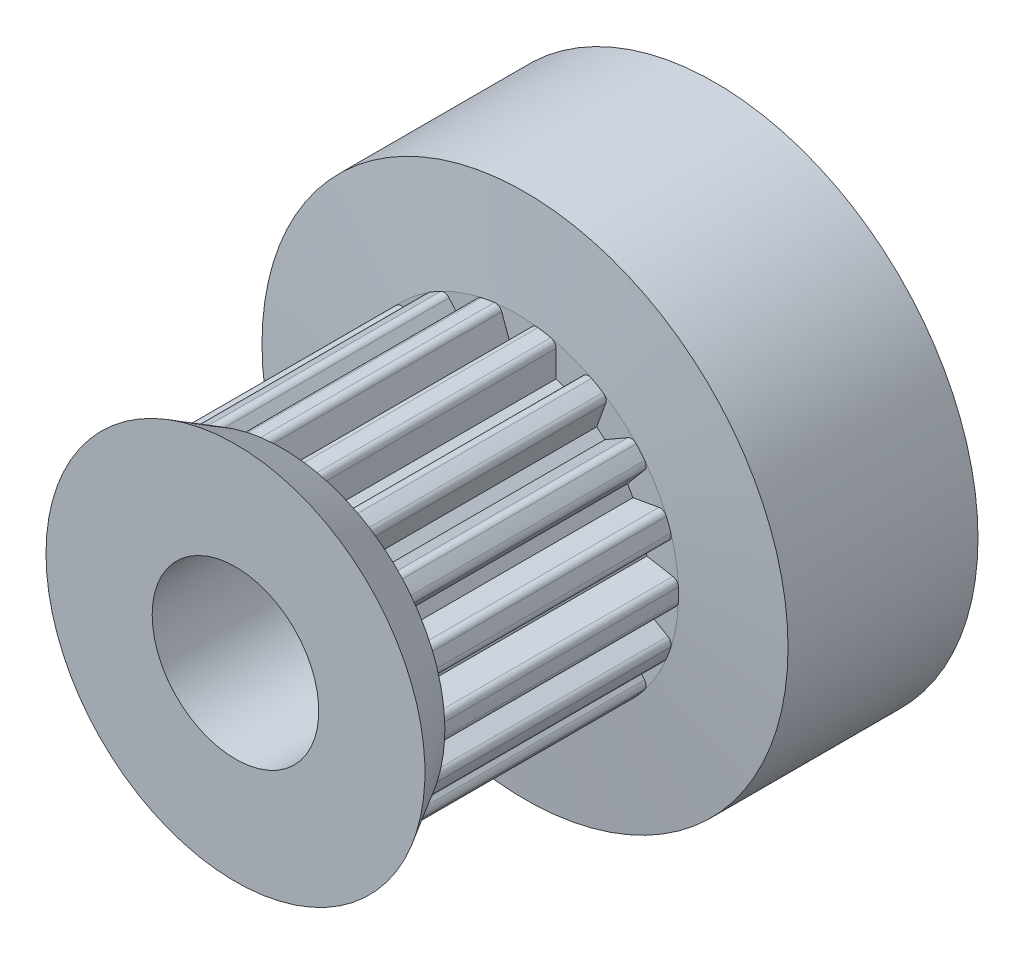
from build123d import *

# Parameters (mm, degrees)
CUT_EXTRUDE1_DEPTH = 4
CIRPATTERN1_COUNT  = 18
SKETCH9_R          = 1.5
CUT_EXTRUDE2_DEPTH = 17.693560834
SKETCH9_3_R        = 1.5
CUT_EXTRUDE3_DEPTH = 5.85


with BuildPart() as part:
    # Sketch8 → Revolve1 (revolve)
    with BuildSketch(Plane(origin=(0, 0, 0), x_dir=(0, 0, -1), z_dir=(1, 0, 0))):
        Polygon((10.801619014, -2.85), (10.801619014, -9), (4.301619014, -9), (4, -5.55625), (-4, -5.55625), (-5.605982468, -6.48346441), (-5.605982468, -2.85), align=None)
    revolve(axis=Axis((0, 0, -7.597913477), (0, 0, 1)))

    # Sketch7 → Cut-Extrude1 (cut, symmetric)
    with BuildSketch(Plane.XY):
        with BuildLine():
            Line((-0.185859831, 4.506434279), (0.185859831, 4.506434279))
            Line((0.185859831, 4.506434279), (0.495499044, 5.357161025))
            ThreePointArc((0.495499044, 5.357161025), (0.592616283, 5.475311352), (0.742358133, 5.506434279))
            ThreePointArc((0.742358133, 5.506434279), (0, 5.55625), (-0.742358133, 5.506434279))
            ThreePointArc((-0.742358133, 5.506434279), (-0.592616283, 5.475311352), (-0.495499044, 5.357161025))
            Line((-0.495499044, 5.357161025), (-0.185859831, 4.506434279))
        make_face()
    cut_extrude1 = extrude(amount=CUT_EXTRUDE1_DEPTH, both=True, mode=Mode.SUBTRACT)

    # CirPattern1: Cut-Extrude1 ×18 about axis
    cirpattern1_axis = Axis((0, 0, -7.597913477), (0, 0, -1))
    for i in range(1, CIRPATTERN1_COUNT):
        add(cut_extrude1.rotate(cirpattern1_axis, i * 360 / CIRPATTERN1_COUNT), mode=Mode.SUBTRACT)

    # Sketch9 → Cut-Extrude2 (cut, through all)
    with BuildSketch(Plane(origin=(0, 0, 0), x_dir=(0, 0, -1), z_dir=(1, 0, 0))):
        with Locations((7.551619014, 0)):
            Circle(SKETCH9_R)
    extrude(amount=-CUT_EXTRUDE2_DEPTH, mode=Mode.SUBTRACT)

    # Sketch9<3> → Cut-Extrude3 (cut)
    with BuildSketch(Plane(origin=(0, 0, 0), x_dir=(0, 0, -1), z_dir=(1, 0, 0))):
        Polygon((10.801619014, 3), (5.819568206, 3), (4.087517399, 0), (5.819568206, -3), (10.801619014, -3), align=None)
        with Locations((7.551619014, 0)):
            Circle(SKETCH9_3_R, mode=Mode.SUBTRACT)
    extrude(amount=-CUT_EXTRUDE3_DEPTH, mode=Mode.SUBTRACT)


solid = part.part
